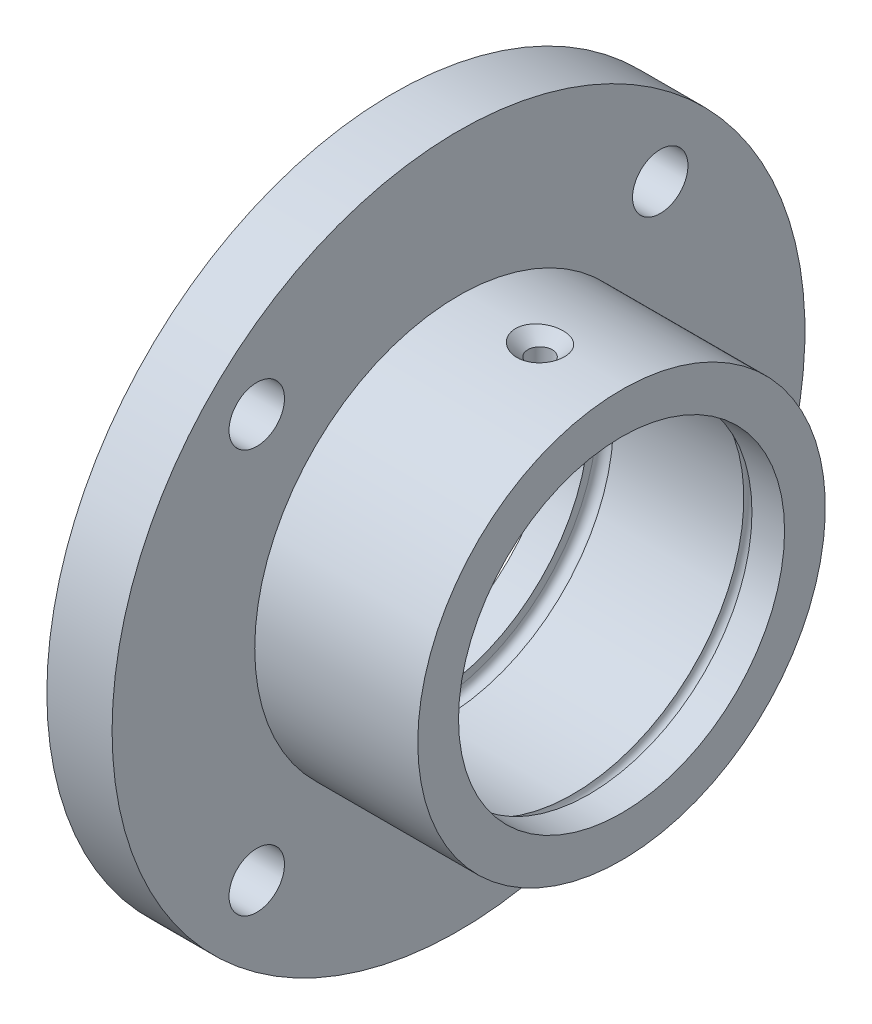
from build123d import *

# Parameters (mm, degrees)
HOLE_WIZARD_M8_1_D           = 6.8
HOLE_WIZARD_M8_1_CSINK_D     = 8.05
HOLE_WIZARD_M8_1_CSINK_ANGLE = 90
PATTERN_CIRCULAR_1_COUNT     = 4


# Read off the part's stored shape, not the designer's step: Ø3.0mm 暗销孔1
with BuildPart() as part:
    # 草图1 → 旋转1 (revolve)
    with BuildSketch(Plane.XY, mode=Mode.PRIVATE) as revolve_1_sk:
        Polygon((0, 0), (0, 42.5), (8, 42.5), (8, 25), (28, 25), (28, 0), align=None)
    revolve(revolve_1_sk.sketch.rotate(Axis((0, 0, 0), (1, 0, 0)), 90), axis=Axis((0, 0, 0), (1, 0, 0)))

    # 草图2 → 切除-旋转1 (revolve, cut)
    with BuildSketch(Plane.XY, mode=Mode.PRIVATE) as cut_revolve_1_sk:
        with BuildLine():
            Line((0, 0), (0, 20))
            Line((0, 20), (4, 20))
            Line((4, 20), (4, 21))
            ThreePointArc((4, 21), (5, 22), (6, 21))
            Line((6, 21), (22, 21))
            ThreePointArc((22, 21), (23, 22), (24, 21))
            Line((24, 21), (24, 20))
            Line((24, 20), (28, 20))
            Line((28, 20), (28, 0))
            Line((28, 0), (0, 0))
        make_face()
    revolve(cut_revolve_1_sk.sketch.rotate(Axis((0, 0, 0), (1, 0, 0)), 90), axis=Axis((0, 0, 0), (1, 0, 0)), mode=Mode.SUBTRACT)

    # Ø3.0mm 暗销孔1 outline → Ø3.0mm 暗销孔1 (revolve, cut)
    with BuildSketch(Plane(origin=(18, 0, 0), x_dir=(1, 0, 0), z_dir=(0, 0, 1))):
        Polygon((3.000038896, 25.000038896), (0, 25.000038896), (0, 20.946331159), (1.5, 20.946331159), (1.5, 23.5), align=None)
    revolve(axis=Axis((18, 0, 0), (0, 1, 0)), mode=Mode.SUBTRACT)

    # M8 螺纹孔1 (through all)
    with Locations(Plane.ZY):
        with Locations((24.748737342, 24.748737342)):
            hole_wizard_m8_1 = CounterSinkHole(HOLE_WIZARD_M8_1_D / 2, HOLE_WIZARD_M8_1_CSINK_D / 2, counter_sink_angle=HOLE_WIZARD_M8_1_CSINK_ANGLE)

    # 阵列(圆周)1: M8 螺纹孔1 ×4 about axis
    pattern_circular_1_axis = Axis((0, 0, 0), (1, 0, 0))
    for i in range(1, PATTERN_CIRCULAR_1_COUNT):
        add(hole_wizard_m8_1.rotate(pattern_circular_1_axis, i * 360 / PATTERN_CIRCULAR_1_COUNT), mode=Mode.SUBTRACT)


solid = part.part
